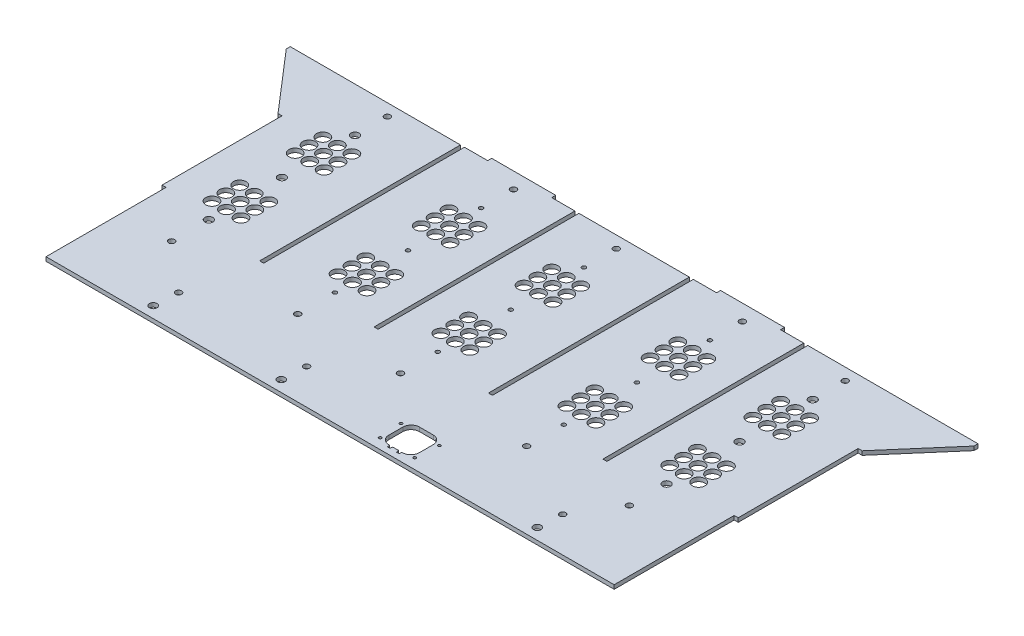
from build123d import *

# Parameters (mm, degrees)
SKETCH1_W               = 457.22286
SKETCH1_H               = 3.175
BOSS_EXTRUDE1_DEPTH     = 241.274380036
BOSS_EXTRUDE3_DEPTH     = 3.175
SKETCH5_W               = 3.175
SKETCH5_H               = 95.25
CUT_EXTRUDE2_DEPTH      = 3.175
SKETCH37_R              = 3
CUT_EXTRUDE12_DEPTH     = 3.175
LPATTERN31_COUNT        = 4
LPATTERN31_PITCH        = 101.6
M4_CLEARANCE_HOLE1_D    = 4.8
LPATTERN32_COUNT        = 3
LPATTERN32_PITCH        = 181.61399999
M4_CLEARANCE_HOLE2_D    = 4.8
LPATTERN33_COUNT        = 2
LPATTERN33_PITCH        = 181.61399999
M4_CLEARANCE_HOLE3_D    = 4.8
SKETCH45_R              = 5
CUT_EXTRUDE13_DEPTH     = 365.26675509
LPATTERN34_COUNT        = 2
LPATTERN34_PITCH        = 181.61399999
SKETCH46_R              = 5
CUT_EXTRUDE14_DEPTH     = 365.26675509
LPATTERN35_COUNT        = 3
LPATTERN35_PITCH        = 181.61399999
SKETCH47_R              = 3.175
CUT_EXTRUDE15_DEPTH     = 365.26675509
SKETCH48_R              = 1.5875
CUT_EXTRUDE16_DEPTH     = 365.26675509
CUT_EXTRUDE17_START     = -3.175
CUT_EXTRUDE17_OUTLINE_R = 1.085
CUT_EXTRUDE17_DEPTH     = 3.175
SKETCH50_W              = 3.175
SKETCH50_H              = 159.38680012
CUT_EXTRUDE18_DEPTH     = 365.266755232
LPATTERN36_COUNT        = 3
LPATTERN36_PITCH        = 90.806999996
LPATTERN36_COL_COUNT    = 2
LPATTERN36_COL_PITCH    = 90.806999996
SKETCH51_W              = 50.8
SKETCH51_H              = 3.175
BOSS_EXTRUDE4_DEPTH     = 3.175


# Read off the part's stored shape, not the designer's step: Cut-Extrude17
with BuildPart() as part:
    # Sketch1 → Boss-Extrude1 (new body)
    with BuildSketch(Plane.XY):
        Rectangle(SKETCH1_W, SKETCH1_H)
    extrude(amount=BOSS_EXTRUDE1_DEPTH)

    # Sketch4 → Boss-Extrude3 (add)
    with BuildSketch(Plane.XZ.offset(1.5875)):
        Polygon((-272.88617, 0), (-228.61143, 0), (-228.61143, 50.8), (-231.78643, 50.8), (-272.88617, 3.175), align=None)
    boss_extrude3 = extrude(amount=-BOSS_EXTRUDE3_DEPTH)

    # Mirror1: Boss-Extrude3 across plane
    add(boss_extrude3.mirror(Plane(origin=(0, 0, 0), x_dir=(0, 0, 1), z_dir=(1, 0, 0))))

    # Sketch5 → Cut-Extrude2 (cut)
    with BuildSketch(Plane.XZ.offset(1.5875)):
        with Locations((-227.02393, 193.649380036)):
            Rectangle(SKETCH5_W, SKETCH5_H)
    cut_extrude2 = extrude(amount=-CUT_EXTRUDE2_DEPTH, mode=Mode.SUBTRACT)

    # Mirror2: Cut-Extrude2 across plane
    add(cut_extrude2.mirror(Plane(origin=(0, 0, 0), x_dir=(0, 0, 1), z_dir=(1, 0, 0))), mode=Mode.SUBTRACT)

    # Sketch37 → Cut-Extrude12 (cut)
    with BuildSketch(Plane(origin=(0, 1.5875, 0), x_dir=(1, 0, 0), z_dir=(0, 1, 0))):
        with Locations(Location((-149.23643, -232.384380036, 0), (0, 0, 270))):
            Circle(SKETCH37_R)
    cut_extrude12 = extrude(amount=-CUT_EXTRUDE12_DEPTH, mode=Mode.SUBTRACT)

    # LPattern31: Cut-Extrude12 ×4, 1 skipped
    with Locations(*[(i * LPATTERN31_PITCH, 0, 0) for i in range(1, LPATTERN31_COUNT) if i not in (2,)]):
        add(cut_extrude12, mode=Mode.SUBTRACT)

    # M4 Clearance Hole1 (through all)
    with Locations(Plane(origin=(0, 1.5875, 0), x_dir=(1, 0, 0), z_dir=(0, 1, 0))):
        with Locations((-186.235499988, -180.775), (-186.235499988, -9.525)):
            m4_clearance_hole1 = Hole(M4_CLEARANCE_HOLE1_D / 2)

    # LPattern32: M4 Clearance Hole1 ×3
    with Locations(*[(i * LPATTERN32_PITCH, 0, 0) for i in range(1, LPATTERN32_COUNT)]):
        add(m4_clearance_hole1, mode=Mode.SUBTRACT)

    # M4 Clearance Hole2 (through all)
    with Locations(Plane(origin=(0, 1.5875, 0), x_dir=(1, 0, 0), z_dir=(0, 1, 0))):
        with Locations((-86.190499988, -180.775), (-86.190499988, -9.525)):
            m4_clearance_hole2 = Hole(M4_CLEARANCE_HOLE2_D / 2)

    # LPattern33: M4 Clearance Hole2 ×2
    with Locations(*[(i * LPATTERN33_PITCH, 0, 0) for i in range(1, LPATTERN33_COUNT)]):
        add(m4_clearance_hole2, mode=Mode.SUBTRACT)

    # M4 Clearance Hole3 (through all)
    with Locations(Plane(origin=(0, 1.5875, 0), x_dir=(1, 0, 0), z_dir=(0, 1, 0))):
        with Locations((-148.209993257, -213.2849914), (-46.609993257, -213.2849914), (156.590006743, -213.2849914)):
            Hole(M4_CLEARANCE_HOLE3_D / 2)

    # Sketch45 → Cut-Extrude13 (cut, through all)
    with BuildSketch(Plane(origin=(0, 1.5875, 0), x_dir=(1, 0, 0), z_dir=(0, 1, 0))):
        with Locations(Location((-74.690499988, -115.256662939, 0), (0, 0, 270))):
            Circle(SKETCH45_R)
        with Locations(Location((-86.190499988, -115.256662939, 0), (0, 0, 270))):
            Circle(SKETCH45_R)
        with Locations(Location((-97.690499988, -115.256662939, 0), (0, 0, 270))):
            Circle(SKETCH45_R)
        with Locations(Location((-97.690499988, -126.256662939, 0), (0, 0, 270))):
            Circle(SKETCH45_R)
        with Locations(Location((-86.190499988, -126.256662939, 0), (0, 0, 270))):
            Circle(SKETCH45_R)
        with Locations(Location((-74.690499988, -126.256662939, 0), (0, 0, 270))):
            Circle(SKETCH45_R)
        with Locations(Location((-97.690499988, -137.256662939, 0), (0, 0, 270))):
            Circle(SKETCH45_R)
        with Locations(Location((-74.690499988, -137.256662939, 0), (0, 0, 270))):
            Circle(SKETCH45_R)
        with Locations(Location((-86.190499988, -137.256662939, 0), (0, 0, 270))):
            Circle(SKETCH45_R)
        with Locations(Location((-97.690499988, -71.256662939, 0), (0, 0, 270))):
            Circle(SKETCH45_R)
        with Locations(Location((-86.190499988, -71.256662939, 0), (0, 0, 270))):
            Circle(SKETCH45_R)
        with Locations(Location((-74.690499988, -71.256662939, 0), (0, 0, 270))):
            Circle(SKETCH45_R)
        with Locations(Location((-74.690499988, -60.256662939, 0), (0, 0, 270))):
            Circle(SKETCH45_R)
        with Locations(Location((-86.190499988, -60.256662939, 0), (0, 0, 270))):
            Circle(SKETCH45_R)
        with Locations(Location((-97.690499988, -60.256662939, 0), (0, 0, 270))):
            Circle(SKETCH45_R)
        with Locations(Location((-97.690499988, -49.256662939, 0), (0, 0, 270))):
            Circle(SKETCH45_R)
        with Locations(Location((-86.190499988, -49.256662939, 0), (0, 0, 270))):
            Circle(SKETCH45_R)
        with Locations(Location((-74.690499988, -49.256662939, 0), (0, 0, 270))):
            Circle(SKETCH45_R)
    cut_extrude13 = extrude(amount=-CUT_EXTRUDE13_DEPTH, mode=Mode.SUBTRACT)

    # LPattern34: Cut-Extrude13 ×2
    with Locations(*[(i * LPATTERN34_PITCH, 0, 0) for i in range(1, LPATTERN34_COUNT)]):
        add(cut_extrude13, mode=Mode.SUBTRACT)

    # Sketch46 → Cut-Extrude14 (cut, through all)
    with BuildSketch(Plane(origin=(0, 1.5875, 0), x_dir=(1, 0, 0), z_dir=(0, 1, 0))):
        with Locations(Location((-174.735499988, -71.256662939, 0), (0, 0, 270))):
            Circle(SKETCH46_R)
        with Locations(Location((-186.235499988, -71.256662939, 0), (0, 0, 270))):
            Circle(SKETCH46_R)
        with Locations(Location((-197.735499988, -71.256662939, 0), (0, 0, 270))):
            Circle(SKETCH46_R)
        with Locations(Location((-197.735499988, -60.256662939, 0), (0, 0, 270))):
            Circle(SKETCH46_R)
        with Locations(Location((-186.235499988, -60.256662939, 0), (0, 0, 270))):
            Circle(SKETCH46_R)
        with Locations(Location((-174.735499988, -60.256662939, 0), (0, 0, 270))):
            Circle(SKETCH46_R)
        with Locations(Location((-174.735499988, -49.256662939, 0), (0, 0, 270))):
            Circle(SKETCH46_R)
        with Locations(Location((-186.235499988, -49.256662939, 0), (0, 0, 270))):
            Circle(SKETCH46_R)
        with Locations(Location((-197.735499988, -49.256662939, 0), (0, 0, 270))):
            Circle(SKETCH46_R)
        with Locations(Location((-174.735499988, -137.256662939, 0), (0, 0, 270))):
            Circle(SKETCH46_R)
        with Locations(Location((-186.235499988, -137.256662939, 0), (0, 0, 270))):
            Circle(SKETCH46_R)
        with Locations(Location((-197.735499988, -137.256662939, 0), (0, 0, 270))):
            Circle(SKETCH46_R)
        with Locations(Location((-197.735499988, -126.256662939, 0), (0, 0, 270))):
            Circle(SKETCH46_R)
        with Locations(Location((-186.235499988, -126.256662939, 0), (0, 0, 270))):
            Circle(SKETCH46_R)
        with Locations(Location((-174.735499988, -126.256662939, 0), (0, 0, 270))):
            Circle(SKETCH46_R)
        with Locations(Location((-197.735499988, -115.256662939, 0), (0, 0, 270))):
            Circle(SKETCH46_R)
        with Locations(Location((-186.235499988, -115.256662939, 0), (0, 0, 270))):
            Circle(SKETCH46_R)
        with Locations(Location((-174.735499988, -115.256662939, 0), (0, 0, 270))):
            Circle(SKETCH46_R)
    cut_extrude14 = extrude(amount=-CUT_EXTRUDE14_DEPTH, mode=Mode.SUBTRACT)

    # LPattern35: Cut-Extrude14 ×3
    with Locations(*[(i * LPATTERN35_PITCH, 0, 0) for i in range(1, LPATTERN35_COUNT)]):
        add(cut_extrude14, mode=Mode.SUBTRACT)

    # Sketch47 → Cut-Extrude15 (cut, through all)
    with BuildSketch(Plane(origin=(0, 1.5875, 0), x_dir=(1, 0, 0), z_dir=(0, 1, 0))):
        with Locations(Location((176.992499984, -151.256662939, 0), (0, 0, 270))):
            Circle(SKETCH47_R)
        with Locations(Location((176.96418, -93.256662939, 0), (0, 0, 270))):
            Circle(SKETCH47_R)
        with Locations(Location((176.992499984, -35.256662939, 0), (0, 0, 270))):
            Circle(SKETCH47_R)
        with Locations(Location((-186.2355, -35.256662939, 0), (0, 0, 270))):
            Circle(SKETCH47_R)
        with Locations(Location((-186.2355, -93.256662939, 0), (0, 0, 270))):
            Circle(SKETCH47_R)
        with Locations(Location((-186.2355, -151.256662939, 0), (0, 0, 270))):
            Circle(SKETCH47_R)
    extrude(amount=-CUT_EXTRUDE15_DEPTH, mode=Mode.SUBTRACT)

    # Sketch48 → Cut-Extrude16 (cut, through all)
    with BuildSketch(Plane(origin=(0, 1.5875, 0), x_dir=(1, 0, 0), z_dir=(0, 1, 0))):
        with Locations(Location((95.423499992, -151.256662939, 0), (0, 0, 270))):
            Circle(SKETCH48_R)
        with Locations(Location((95.423499992, -93.256662939, 0), (0, 0, 270))):
            Circle(SKETCH48_R)
        with Locations(Location((95.423499992, -35.256662939, 0), (0, 0, 270))):
            Circle(SKETCH48_R)
        with Locations(Location((-4.62150001, -35.256662939, 0), (0, 0, 270))):
            Circle(SKETCH48_R)
        with Locations(Location((-4.62150001, -93.256662939, 0), (0, 0, 270))):
            Circle(SKETCH48_R)
        with Locations(Location((-4.62150001, -151.256662939, 0), (0, 0, 270))):
            Circle(SKETCH48_R)
        with Locations(Location((-86.1905, -35.256662939, 0), (0, 0, 270))):
            Circle(SKETCH48_R)
        with Locations(Location((-86.1905, -93.256662939, 0), (0, 0, 270))):
            Circle(SKETCH48_R)
        with Locations(Location((-86.1905, -151.256662939, 0), (0, 0, 270))):
            Circle(SKETCH48_R)
    extrude(amount=-CUT_EXTRUDE16_DEPTH, mode=Mode.SUBTRACT)

    # Cut-Extrude17 outline → Cut-Extrude17 (cut)
    with BuildSketch(Plane(origin=(0, 1.5875, 0), x_dir=(1, 0, 0), z_dir=(0, 1, 0)).offset(CUT_EXTRUDE17_START)):
        with BuildLine():
            Line((33.207549391, -216.718420316), (33.207549391, -227.918420316))
            add(Edge.make_bspline(
                [(33.207549391, -227.918420316), (33.207549391, -228.319263085), (33.276785105, -229.104904121), (33.740309787, -230.764306533), (34.99747512, -232.709494587), (36.942663174, -233.96665992), (38.602065586, -234.430184602), (39.387706622, -234.499420316), (39.788549391, -234.499420316)],
                knots=[0, 0, 0, 0, 0.125, 0.25, 0.5, 0.75, 0.875, 1, 1, 1, 1], degree=3))
            Line((39.788549391, -234.499420316), (40.439427221, -234.499420316))
            Line((40.439427221, -234.499420316), (40.614404717, -236.499420465))
            Line((40.614404717, -236.499420465), (42.762694422, -236.499420465))
            Line((42.762694422, -236.499420465), (42.937671577, -234.499420316))
            Line((42.937671577, -234.499420316), (47.639427221, -234.499420316))
            Line((47.639427221, -234.499420316), (47.814404717, -236.499420465))
            Line((47.814404717, -236.499420465), (49.962694422, -236.499420465))
            Line((49.962694422, -236.499420465), (50.137671577, -234.499420316))
            Line((50.137671577, -234.499420316), (50.788549391, -234.499420316))
            add(Edge.make_bspline(
                [(50.788549391, -234.499420316), (51.18939216, -234.499420316), (51.975033197, -234.430184602), (53.634435609, -233.96665992), (55.579623663, -232.709494587), (56.836788995, -230.764306533), (57.300313678, -229.104904121), (57.369549391, -228.319263085), (57.369549391, -227.918420316)],
                knots=[0, 0, 0, 0, 0.125, 0.25, 0.5, 0.75, 0.875, 1, 1, 1, 1], degree=3))
            Line((57.369549391, -227.918420316), (57.369549391, -216.718420316))
            add(Edge.make_bspline(
                [(57.369549391, -216.718420316), (57.369549391, -216.317577547), (57.300313678, -215.53193651), (56.836788995, -213.872534099), (55.579623663, -211.927346045), (53.634435609, -210.670180712), (51.975033197, -210.206656029), (51.18939216, -210.137420316), (50.788549391, -210.137420316)],
                knots=[0, 0, 0, 0, 0.125, 0.25, 0.5, 0.75, 0.875, 1, 1, 1, 1], degree=3))
            Line((50.788549391, -210.137420316), (39.788549391, -210.137420316))
            add(Edge.make_bspline(
                [(39.788549391, -210.137420316), (39.387706622, -210.137420316), (38.602065586, -210.206656029), (36.942663174, -210.670180712), (34.99747512, -211.927346045), (33.740309787, -213.872534099), (33.276785105, -215.53193651), (33.207549391, -216.317577547), (33.207549391, -216.718420316)],
                knots=[0, 0, 0, 0, 0.125, 0.25, 0.5, 0.75, 0.875, 1, 1, 1, 1], degree=3))
        make_face()
        with Locations((60.488550211, -215.018421135)):
            Circle(CUT_EXTRUDE17_OUTLINE_R)
        with Locations((30.088550211, -215.018421135)):
            Circle(CUT_EXTRUDE17_OUTLINE_R)
        with Locations((31.588550211, -233.118421135)):
            Circle(CUT_EXTRUDE17_OUTLINE_R)
        with Locations((58.988550211, -233.118421135)):
            Circle(CUT_EXTRUDE17_OUTLINE_R)
    extrude(amount=CUT_EXTRUDE17_DEPTH, mode=Mode.SUBTRACT)

    # Sketch50 → Cut-Extrude18 (cut, through all)
    with BuildSketch(Plane(origin=(0, 1.5875, 0), x_dir=(1, 0, 0), z_dir=(0, 1, 0))):
        with Locations((45.401000012, -79.69340006)):
            Rectangle(SKETCH50_W, SKETCH50_H)
    cut_extrude18 = extrude(amount=-CUT_EXTRUDE18_DEPTH, mode=Mode.SUBTRACT)

    # LPattern36: Cut-Extrude18 ×3
    with Locations(*[(-i * LPATTERN36_PITCH, 0, 0) for i in range(1, LPATTERN36_COUNT)]):
        add(cut_extrude18, mode=Mode.SUBTRACT)

    # LPattern36 col: Cut-Extrude18 ×2
    with Locations(*[(i * LPATTERN36_COL_PITCH, 0, 0) for i in range(1, LPATTERN36_COL_COUNT)]):
        add(cut_extrude18, mode=Mode.SUBTRACT)

    # Sketch51 → Boss-Extrude4 (add)
    with BuildSketch(Plane(origin=(0, 0, 0), x_dir=(-1, 0, 0), z_dir=(0, 0, -1))):
        with Locations((-90.8045, 0)):
            Rectangle(SKETCH51_W, SKETCH51_H)
    boss_extrude4 = extrude(amount=BOSS_EXTRUDE4_DEPTH)

    # Mirror3: Boss-Extrude4 across plane
    add(boss_extrude4.mirror(Plane(origin=(0, 0, 0), x_dir=(0, 0, 1), z_dir=(1, 0, 0))))


solid = part.part
